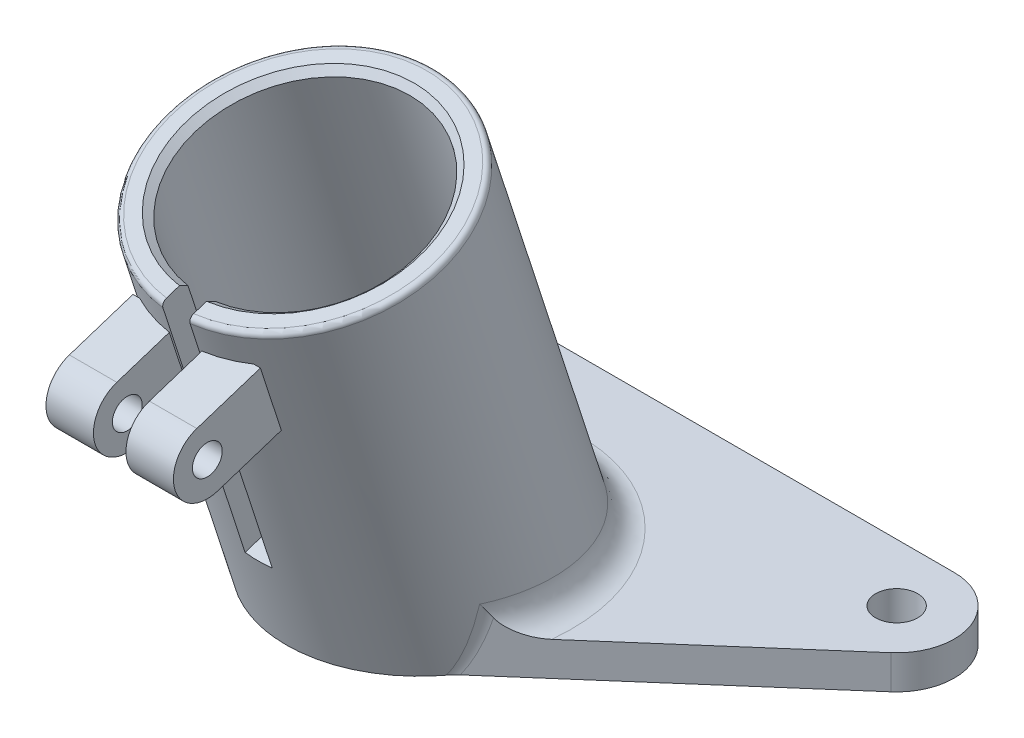
from build123d import *

# Parameters (mm, degrees)
SKETCH1_R               = 1.55
BOSS_EXTRUDE1_DEPTH     = 2.5
SWEEP1_PROFILE_R        = 10
CUT_EXTRUDE1_DEPTH      = 49.64978207
CUT_EXTRUDE1_DEPTH_BACK = 20
SKETCH20_R              = 8.1
SKETCH21_R              = 10
BOSS_EXTRUDE5_DEPTH     = 5
CUT_EXTRUDE3_DEPTH      = 55.246484574
CUT_EXTRUDE3_DEPTH_BACK = 55.246484574
SKETCH22_W              = 45
SKETCH22_H              = 12.603141468
CUT_EXTRUDE4_DEPTH      = 46.477836925
CUT_EXTRUDE4_DEPTH_BACK = 5
SKETCH28_W              = 2
SKETCH28_H              = 20
BOSS_EXTRUDE6_START     = 1.2
SKETCH29_R              = 1.1
BOSS_EXTRUDE6_DEPTH     = 3.5
BOSS_EXTRUDE7_START     = -4.7
SKETCH29_3_R            = 1.1
BOSS_EXTRUDE7_DEPTH     = 3.5
CHAMFER1_SIZE           = 0.5
FILLET1_R               = 2
FILLET3_R               = 0.4


with BuildPart() as part:
    # Sketch1 → Boss-Extrude1 (new body)
    with BuildSketch(Plane(origin=(0, 0, 0), x_dir=(1, 0, 0), z_dir=(0, 1, 0))):
        with BuildLine():
            ThreePointArc((-22.5, 16.25), (-26.479501852, 13.492000338), (-25.294079109, 8.797560003))
            Line((-25.294079109, 8.797560003), (-6.574303786, -7.535152933))
            ThreePointArc((-6.574303786, -7.535152933), (0, -10), (6.574303786, -7.535152933))
            Line((6.574303786, -7.535152933), (25.294079109, 8.797560003))
            ThreePointArc((25.294079109, 8.797560003), (26.479501852, 13.492000338), (22.5, 16.25))
            Line((22.5, 16.25), (-22.5, 16.25))
        make_face()
        with Locations((-22.5, 12)):
            Circle(SKETCH1_R, mode=Mode.SUBTRACT)
        with Locations((22.5, 12)):
            Circle(SKETCH1_R, mode=Mode.SUBTRACT)
    extrude(amount=BOSS_EXTRUDE1_DEPTH)

    # Sweep1: sweep along a curve in space
    with BuildLine() as sweep1_path:
        Line((0, 0, 0), (0, 28.531695489, 9.270509831))
    # Sweep1 profile (on start of the path) → Sweep1 (sweep)
    with BuildSketch(Plane(origin=(0, 0, 0), x_dir=(0, -0.3090169943749482, 0.9510565162951534), z_dir=(0, 0.9510565162951534, 0.3090169943749482))):
        Circle(SWEEP1_PROFILE_R)
    sweep(path=sweep1_path.line)

    # Sketch20 → Cut-Extrude1 (cut, two sides: drawn at the far end of the back side and taken through both)
    with BuildSketch(Plane(origin=(0, 28.531695489, 9.270509831), x_dir=(1, 0, 0), z_dir=(0, 0.9510565162951533, 0.3090169943749481)).offset(-CUT_EXTRUDE1_DEPTH_BACK)):
        Circle(SKETCH20_R)
    extrude(amount=CUT_EXTRUDE1_DEPTH + CUT_EXTRUDE1_DEPTH_BACK, mode=Mode.SUBTRACT)

    # Sketch21 → Boss-Extrude5 (add)
    with BuildSketch(Plane(origin=(0, 0, 0), x_dir=(1, 0, 0), z_dir=(0, -0.9510565162951533, -0.3090169943749481))):
        Circle(SKETCH21_R)
    extrude(amount=BOSS_EXTRUDE5_DEPTH)

    # Sketch22 → Cut-Extrude3 (cut, two sides: drawn at the far end of the back side and taken through both)
    with BuildSketch(Plane(origin=(0, 0, -16.25), x_dir=(-1, 0, 0), z_dir=(0, 0, -1)).offset(-CUT_EXTRUDE3_DEPTH_BACK)):
        with Locations((0, -6.301570734)):
            Rectangle(SKETCH22_W, SKETCH22_H)
    extrude(amount=CUT_EXTRUDE3_DEPTH + CUT_EXTRUDE3_DEPTH_BACK, mode=Mode.SUBTRACT)

    # Sketch28 → Cut-Extrude4 (cut, two sides: drawn at the far end of the back side and taken through both)
    with BuildSketch(Plane(origin=(0, 0, 0), x_dir=(1, 0, 0), z_dir=(0, -0.3090169943749482, 0.9510565162951534)).offset(-CUT_EXTRUDE4_DEPTH_BACK)):
        with Locations((0, 20)):
            Rectangle(SKETCH28_W, SKETCH28_H)
    extrude(amount=CUT_EXTRUDE4_DEPTH + CUT_EXTRUDE4_DEPTH_BACK, mode=Mode.SUBTRACT)

    # Sketch29 → Boss-Extrude6 (add)
    with BuildSketch(Plane(origin=(0, 0, 0), x_dir=(0, 0, -1), z_dir=(1, 0, 0)).offset(BOSS_EXTRUDE6_START)):
        with BuildLine():
            ThreePointArc((-21.812758573, 21.827816277), (-23.417857378, 18.6776325), (-20.267673602, 17.072533695))
            Line((-20.267673602, 17.072533695), (-15.58048511, 18.595493556))
            Line((-15.58048511, 18.595493556), (-17.125570082, 23.350776138))
            Line((-17.125570082, 23.350776138), (-21.812758573, 21.827816277))
        make_face()
        with Locations((-21.040216088, 19.450174986)):
            Circle(SKETCH29_R, mode=Mode.SUBTRACT)
    extrude(amount=BOSS_EXTRUDE6_DEPTH)

    # Sketch29<3> → Boss-Extrude7 (add)
    with BuildSketch(Plane(origin=(0, 0, 0), x_dir=(0, 0, -1), z_dir=(1, 0, 0)).offset(BOSS_EXTRUDE7_START)):
        with BuildLine():
            ThreePointArc((-21.812758573, 21.827816277), (-23.417857378, 18.6776325), (-20.267673602, 17.072533695))
            Line((-20.267673602, 17.072533695), (-15.58048511, 18.595493556))
            Line((-15.58048511, 18.595493556), (-17.125570082, 23.350776138))
            Line((-17.125570082, 23.350776138), (-21.812758573, 21.827816277))
        make_face()
        with Locations((-21.040216088, 19.450174986)):
            Circle(SKETCH29_3_R, mode=Mode.SUBTRACT)
    extrude(amount=BOSS_EXTRUDE7_DEPTH)

    # Chamfer1
    chamfer1_edges = [part.edges().sort_by_distance(p)[0] for p in [
        (0, 31.034733143, 1.566952049),
    ]]
    chamfer(chamfer1_edges, length=CHAMFER1_SIZE)

    # Fillet1
    fillet1_edges = [part.edges().sort_by_distance(p)[0] for p in [
        (-8.585106855, 1.196928737, 5.780758517),
        (8.585106855, 1.196928737, 5.780758517),
        (0, 2.5, -9.702323002),
    ]]
    fillet(fillet1_edges, radius=FILLET1_R)

    # Fillet3
    fillet3_edges = [part.edges().sort_by_distance(p)[0] for p in [
        (0, 31.621865433, -0.240055332),
    ]]
    fillet(fillet3_edges, radius=FILLET3_R)


solid = part.part
